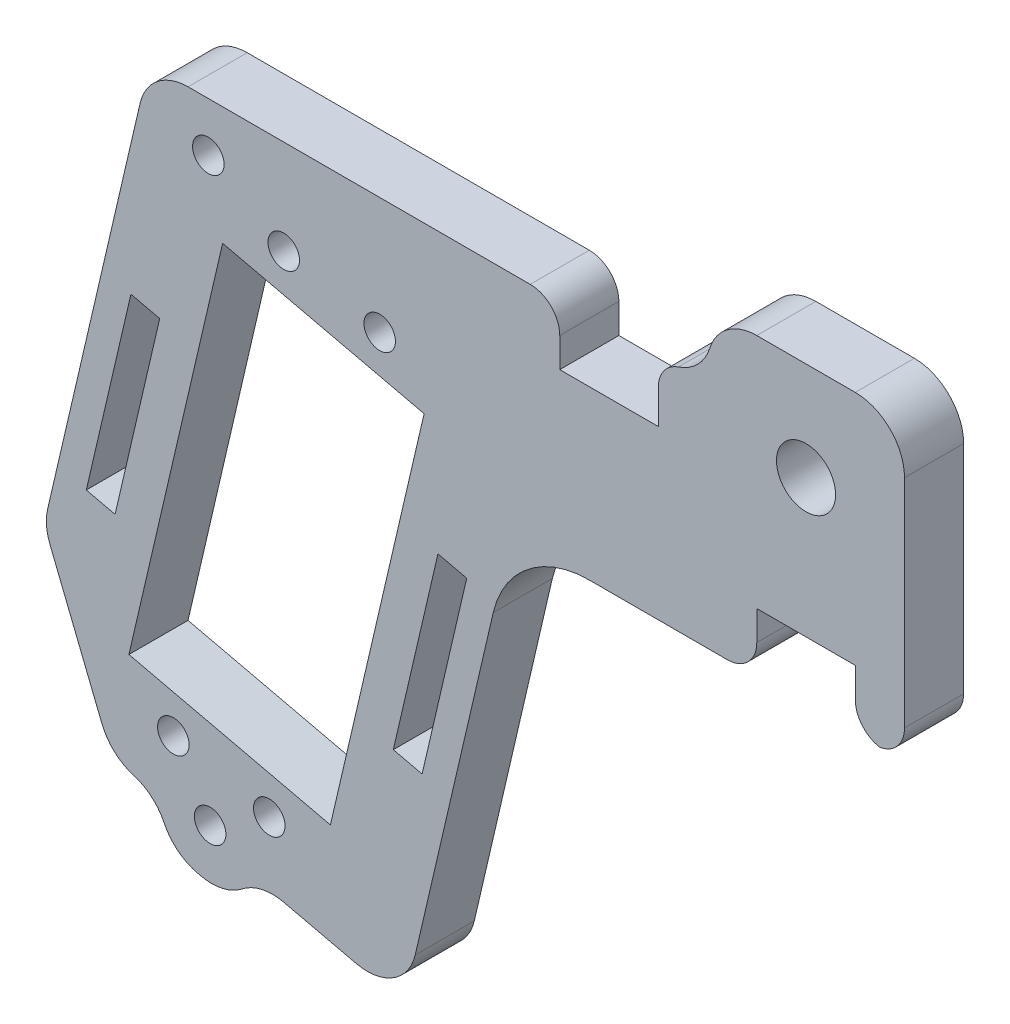
from build123d import *

# Parameters (mm, degrees)
ESBO_O1_R                = 1.599999999999999
ESBO_O1_R_2              = 1.600000000000006
ESBO_O1_R_3              = 1.5999999999999974
ESBO_O1_R_4              = 1.5999999999999985
ESBO_O1_R_5              = 1.5999999999999979
ESBO_O1_R_6              = 1.600000000000005
ESBO_O1_R_7              = 3.0000000000000013
RESSALTO_EXTRUS_O1_DEPTH = 6
FILETE1_R                = 10
FILETE2_R                = 5
FILETE4_R                = 5
FILETE5_R                = 3
CHANFRO1_SIZE            = 15
CHANFRO1_SIZE2           = 10.50311307314568
FILETE6_R                = 5


# Some blends are built 0.0001 mm under size
with BuildPart() as part:
    # Esboço1 → Ressalto-extrusão1 (new body)
    with BuildSketch(Plane.XY):
        Polygon((10.000000000000002, -2e-17), (9.999999999999998, 30.00000000000003), (-10.000000000000002, 30.000000000000025), (-10.000000000000002, 23.000000000000007), (-15.00000000000002, 22.99999999999999), (-15, 16.999999999999996), (-25, 17), (-25.000000000000007, 22.999999999999993), (-66.7010377283415, 23.00000000000001), (-80.7428791412217, -37.388961654722294), (-65.64563872754113, -40.899422007942356), (-66.49494365170727, -44.55198017254248), (-56.754788546106894, -46.81679330365219), (-55.90548362194075, -43.16423513905207), (-40.8082432082602, -46.674695492272136), (-29.95528839436153, 0), (-5.0000000000000036, -3e-17), (-5.000000000000001, 5.999999999999998), (4.999999999999999, 6), (5, -9.54e-15), align=None)
        with Locations((-60.49245953335221, -40.814309185297155)):
            Circle(ESBO_O1_R, mode=Mode.SUBTRACT)
        with Locations((-64.23013052059758, -34.81182506694214)):
            Circle(ESBO_O1_R_2, mode=Mode.SUBTRACT)
        with Locations((-54.48997541499719, -37.07663819805185)):
            Circle(ESBO_O1_R_3, mode=Mode.SUBTRACT)
        Polygon((-70.14267850253108, -18.293523811627352), (-73.06472503421121, -17.614079872294436), (-68.53509877199178, 1.8662303389063057), (-65.61305224031166, 1.1867863995733938), align=None, mode=Mode.SUBTRACT)
        Polygon((-48.28358518275084, -34.66972725556205), (-68.73791090451164, -29.91361968023165), (-59.22569575385083, 10.995031763289926), (-38.771370032090054, 6.238924187959523), align=None, mode=Mode.SUBTRACT)
        Polygon((-34.44455590239049, -6.060615619977673), (-38.97418216460991, -25.540925831178406), (-41.89622869629001, -24.861481891845497), (-37.3666024340706, -5.3811716806447585), align=None, mode=Mode.SUBTRACT)
        with Locations((-60.67691042150691, 18.000000000000004)):
            Circle(ESBO_O1_R_4, mode=Mode.SUBTRACT)
        with Locations((-53.019305521604494, 13.40194270577972)):
            Circle(ESBO_O1_R_5, mode=Mode.SUBTRACT)
        with Locations((-43.2791504160041, 11.137129574670004)):
            Circle(ESBO_O1_R_6, mode=Mode.SUBTRACT)
        with Locations((-2.44e-15, 20)):
            Circle(ESBO_O1_R_7, mode=Mode.SUBTRACT)
    extrude(amount=RESSALTO_EXTRUS_O1_DEPTH)

    # Filete1
    filete1_edges = [part.edges().sort_by_distance(p)[0] for p in [
        (-29.95528839436153, -3e-17, 3),
    ]]
    fillet(filete1_edges, radius=FILETE1_R)

    # Filete2
    # the kernel refuses this fillet: 5 mm, written as the material it takes off along each edge
    with BuildSketch(Plane(origin=(-66.70103772834149, 23.00000000000001, -9.926929788370014), x_dir=(-0.22648131311097233, -0.974015510560037, 0), z_dir=(0, 0, 1))) as filete2_piece_1:
        with BuildLine():
            CenterArc((FILETE2_R * 0.79415438307, FILETE2_R), FILETE2_R, 193.08999999999958, 76.91000000000048)
            Line((-FILETE2_R * 0.17986112749, FILETE2_R * 0.773518686889), (-FILETE2_R * 0.199341437702, FILETE2_R * 0.768989060627))
            Line((-FILETE2_R * 0.199341437702, FILETE2_R * 0.768989060627), (-FILETE2_R * 0.0158830876614, -FILETE2_R * 0.02))
            Line((-FILETE2_R * 0.0158830876614, -FILETE2_R * 0.02), (FILETE2_R * 0.79415438307, -FILETE2_R * 0.02))
            Line((FILETE2_R * 0.79415438307, -FILETE2_R * 0.02), (FILETE2_R * 0.79415438307, 6e-17))
        make_face()
    extrude(amount=25.853859576740028, mode=Mode.SUBTRACT)
    with BuildSketch(Plane(origin=(-66.49494365170727, -44.55198017254248, -12.103072956898195), x_dir=(0.9740155105600374, -0.22648131311097125, 0), z_dir=(0, 0, 1))) as filete2_piece_2:
        with BuildLine():
            CenterArc((4.841229182759275, 5.000000000000003), FILETE2_R, 194.4775121859302, 75.52248781406985)
            Line((1.133e-14, 3.7499999999999782), (-0.09682458365516827, 3.7249999999999814))
            ThreePointArc((-0.09682458365516827, 3.7249999999999814), (-0.10000000000000146, 1.874999999999995), (-0.10000000000000632, 2.39e-15))
            Line((-0.10000000000000632, 2.39e-15), (-4e-15, -0.0999999999999994))
            Line((-4e-15, -0.0999999999999994), (4.841229182759282, -0.09999999999999787))
            Line((4.841229182759282, -0.09999999999999787), (4.841229182759279, -9e-17))
        make_face()
    extrude(amount=30.20614591379639, mode=Mode.SUBTRACT)
    with BuildSketch(Plane(origin=(-56.754788546106894, -46.81679330365219, -12.103072956898142), x_dir=(0.22648131311097194, 0.9740155105600371, 0), z_dir=(0, 0, 1))) as filete2_piece_3:
        with BuildLine():
            CenterArc((4.9999999999999964, 4.841229182759264), FILETE2_R, 180.00000000000009, 75.52248781406979)
            Line((-5.64e-15, 4.841229182759256), (-0.10000000000000338, 4.841229182759253))
            Line((-0.10000000000000338, 4.841229182759253), (-0.09999999999999777, -2.99e-15))
            Line((-0.09999999999999777, -2.99e-15), (2.99e-15, -0.09999999999999777))
            ThreePointArc((2.99e-15, -0.09999999999999777), (1.8749999999999951, -0.10000000000000121), (3.724999999999985, -0.09682458365518365))
            Line((3.724999999999985, -0.09682458365518365), (3.7499999999999827, 3e-17))
        make_face()
    extrude(amount=30.206145913796284, mode=Mode.SUBTRACT)
    with BuildSketch(Plane(origin=(-40.8082432082602, -46.674695492272136, -12.500000000000021), x_dir=(0.22648131311097006, 0.9740155105600377, 0), z_dir=(0, 0, 1))) as filete2_piece_4:
        with BuildLine():
            CenterArc((FILETE2_R, FILETE2_R), FILETE2_R, 179.9999999999999, 90)
            Line((2.239e-14, FILETE2_R), (-FILETE2_R * 0.02, FILETE2_R))
            Line((-FILETE2_R * 0.02, FILETE2_R), (-FILETE2_R * 0.02, -FILETE2_R * 0.02))
            Line((-FILETE2_R * 0.02, -FILETE2_R * 0.02), (FILETE2_R, -FILETE2_R * 0.02))
            Line((FILETE2_R, -FILETE2_R * 0.02), (FILETE2_R, 6e-17))
        make_face()
    extrude(amount=31.000000000000043, mode=Mode.SUBTRACT)
    with BuildSketch(Plane(origin=(-10.000000000000002, 30.000000000000025, -12.499999999999996), x_dir=(1, 0, 0), z_dir=(0, 0, 1))) as filete2_piece_5:
        with BuildLine():
            CenterArc((FILETE2_R, -FILETE2_R), FILETE2_R, 90.00000000000001, 89.99999999999996)
            Line((-1.78e-15, -FILETE2_R), (-FILETE2_R * 0.02, -FILETE2_R))
            Line((-FILETE2_R * 0.02, -FILETE2_R), (-FILETE2_R * 0.02, FILETE2_R * 0.02))
            Line((-FILETE2_R * 0.02, FILETE2_R * 0.02), (FILETE2_R, FILETE2_R * 0.02))
            Line((FILETE2_R, FILETE2_R * 0.02), (FILETE2_R, 0))
        make_face()
    extrude(amount=30.999999999999993, mode=Mode.SUBTRACT)
    with BuildSketch(Plane(origin=(9.999999999999998, 30.00000000000003, -12.5), x_dir=(0, -1, 0), z_dir=(0, 0, 1))) as filete2_piece_6:
        with BuildLine():
            CenterArc((FILETE2_R, -FILETE2_R), FILETE2_R, 90, 90)
            Line((0, -FILETE2_R), (-FILETE2_R * 0.02, -FILETE2_R))
            Line((-FILETE2_R * 0.02, -FILETE2_R), (-FILETE2_R * 0.02, FILETE2_R * 0.02))
            Line((-FILETE2_R * 0.02, FILETE2_R * 0.02), (FILETE2_R, FILETE2_R * 0.02))
            Line((FILETE2_R, FILETE2_R * 0.02), (FILETE2_R, 0))
        make_face()
    extrude(amount=31, mode=Mode.SUBTRACT)

    # Filete4
    filete4_edges = [part.edges().sort_by_distance(p)[0] for p in [
        (-65.64563872754113, -40.89942200794236, 3),
        (-55.90548362194075, -43.16423513905207, 3),
        (-10.000000000000002, 23, 3),
    ]]
    fillet(filete4_edges, radius=FILETE4_R - 0.0001)  # a hair under: the kernel refuses the full size

    # Filete5
    # the kernel refuses this fillet: 3 mm, written as the material it takes off along each edge
    with BuildSketch(Plane(origin=(-25.000000000000007, 23.000000000000007, -7.499999999999991), x_dir=(-1, 0, 0), z_dir=(0, 0, 1))) as filete5_piece_1:
        with BuildLine():
            CenterArc((FILETE5_R, FILETE5_R), FILETE5_R, 180.00000000000006, 89.99999999999994)
            Line((-3.55e-15, FILETE5_R), (0, 0))
            Line((0, 0), (FILETE5_R, 0))
        make_face()
    extrude(amount=20.99999999999998, mode=Mode.SUBTRACT)
    with BuildSketch(Plane(origin=(-15.00000000000002, 22.99999999999999, -6.465722061975505), x_dir=(3.43e-15, -1, 0), z_dir=(0, 0, 1))) as filete5_piece_2:
        with BuildLine():
            CenterArc((2.5862888247905, 3), FILETE5_R, 198.50689627931516, 71.49310372068487)
            Line((-0.25856754520870956, 2.0477436090658623), (-0.5430531822086313, 1.9525179699724493))
            ThreePointArc((-0.5430531822086313, 1.9525179699724493), (-0.2999999999996936, 0.4606813660513637), (-0.3000000000000007, 1.03e-15))
            Line((-0.3000000000000007, 1.03e-15), (-1.03e-15, -0.3000000000000007))
            Line((-1.03e-15, -0.3000000000000007), (2.5862888247904996, -0.3000000000000007))
            Line((2.5862888247904996, -0.3000000000000007), (2.5862888247905005, 0))
        make_face()
    extrude(amount=18.93144412395101, mode=Mode.SUBTRACT)
    with BuildSketch(Plane(origin=(-5.0000000000000036, -3e-17, -7.5), x_dir=(-1, 1e-17, 0), z_dir=(0, 0, 1))) as filete5_piece_3:
        with BuildLine():
            CenterArc((FILETE5_R, -FILETE5_R), FILETE5_R, 90, 90)
            Line((3e-17, -FILETE5_R), (0, 0))
            Line((0, 0), (FILETE5_R, 0))
        make_face()
    extrude(amount=21, mode=Mode.SUBTRACT)
    with BuildSketch(Plane(origin=(10.000000000000002, -2e-17, -7.500000000000002), x_dir=(-1, 1e-17, 0), z_dir=(0, 0, 1))) as filete5_piece_4:
        with BuildLine():
            CenterArc((FILETE5_R, -FILETE5_R), FILETE5_R, 90, 90)
            Line((1.79e-15, -FILETE5_R), (0, 0))
            Line((0, 0), (FILETE5_R, 0))
        make_face()
    extrude(amount=21, mode=Mode.SUBTRACT)
    with BuildSketch(Plane(origin=(5, 0, -7.5), x_dir=(-3e-16, 1, 0), z_dir=(0, 0, 1))) as filete5_piece_5:
        with BuildLine():
            CenterArc((FILETE5_R, -FILETE5_R), FILETE5_R, 90, 90)
            Line((-8.9e-16, -FILETE5_R), (0, 0))
            Line((0, 0), (FILETE5_R, 0))
        make_face()
    extrude(amount=21, mode=Mode.SUBTRACT)

    # Chanfro1
    chanfro1_edges = [part.edges().sort_by_distance(p)[0] for p in [
        (-80.7428791412217, -37.388961654722294, 3),
    ]]
    chanfro1_side = [part.faces().sort_by_distance(p)[0] for p in [
        (-74.1716112535079, -9.128277544584641, 3),
    ]]
    chamfer(chanfro1_edges, length=CHANFRO1_SIZE, length2=CHANFRO1_SIZE2, reference=chanfro1_side[0])

    # Filete6
    filete6_edges = [part.edges().sort_by_distance(p)[0] for p in [
        (-77.34565944455714, -22.778728996321732, 3),
        (-70.51268409881192, -39.76772049528134, 3),
    ]]
    fillet(filete6_edges, radius=FILETE6_R)


solid = part.part
